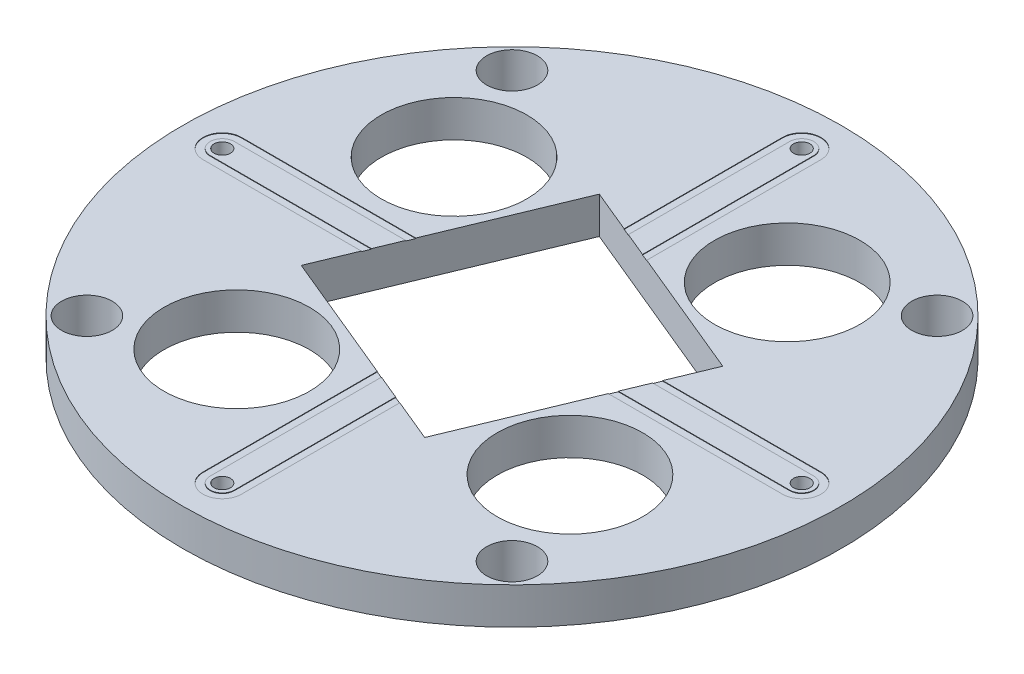
from build123d import *

# Parameters (mm, degrees)
BODAY_SKETCH_R        = 11.557
BODY_DEPTH            = 1.27
COPPER_START          = 0.017500092
COPPER_SKETCH_R       = 11.557
COPPER_DEPTH          = 0.017500092
F_0_CLEARANCE_HOLE1_D = 1.778
SCREW_HOLES_COUNT     = 4
GAP_CUT_DEPTH         = 17.39333395
CENTER_DEPTH          = 0.017500092
IO_HOLE_SKETCH_R      = 0.287000061
IO_HOLE_DEPTH         = 17.39333395
GAP_CUTS_COUNT        = 4
CENTERS_COUNT         = 4
IO_HOLES_COUNT        = 4
POCKET_DEPTH          = 17.39333395
POCKET_DEPTH_BACK     = 17.39333395
POSTS_R               = 2.5527
POST_CUT_DEPTH        = 17.39333395
POST_CUTS_COUNT       = 4


with BuildPart() as part:
    # Boday Sketch → Body (new body)
    with BuildSketch(Plane(origin=(0, 0, 0), x_dir=(1, 0, 0), z_dir=(0, 1, 0))):
        Circle(BODAY_SKETCH_R)
    extrude(amount=-BODY_DEPTH)

    # Copper Sketch → Copper (add)
    with BuildSketch(Plane(origin=(0, 0, 0), x_dir=(1, 0, 0), z_dir=(0, 1, 0)).offset(COPPER_START)):
        Circle(COPPER_SKETCH_R)
    extrude(amount=-COPPER_DEPTH)

    # #0 Clearance Hole1 (through all)
    with Locations(Plane(origin=(0, 0.017500092, 0), x_dir=(-1, 0, 0), z_dir=(0, 1, 0))):
        with Locations((7.45361258, -7.45361258)):
            f_0_clearance_hole1 = Hole(F_0_CLEARANCE_HOLE1_D / 2)

    # Screw Holes: #0 Clearance Hole1 ×4 about axis
    screw_holes_axis = Axis((0, 0.0762, 0), (0, -1, 0))
    for i in range(1, SCREW_HOLES_COUNT):
        add(f_0_clearance_hole1.rotate(screw_holes_axis, i * 360 / SCREW_HOLES_COUNT), mode=Mode.SUBTRACT)

    # Gap → Gap Cut (cut, through all)
    with BuildSketch(Plane(origin=(0, 0, 0), x_dir=(1, 0, 0), z_dir=(0, 1, 0))):
        with BuildLine():
            Line((0.675000047, 0), (0.675000047, 10.16))
            ThreePointArc((0.675000047, 10.16), (0, 10.835000047), (-0.675000047, 10.16))
            Line((-0.675000047, 10.16), (-0.675000047, 0))
            Line((-0.675000047, 0), (0.675000047, 0))
        make_face()
    gap_cut = extrude(amount=GAP_CUT_DEPTH, mode=Mode.SUBTRACT)


with BuildPart() as body_2:
    # Center Sketch → Center (new body)
    with BuildSketch(Plane(origin=(0, 0, 0), x_dir=(1, 0, 0), z_dir=(0, 1, 0))):
        with BuildLine():
            Line((0.425000039, 0), (0.425000039, 10.16))
            ThreePointArc((0.425000039, 10.16), (0, 10.585000039), (-0.425000039, 10.16))
            Line((-0.425000039, 10.16), (-0.425000039, 0))
            Line((-0.425000039, 0), (0.425000039, 0))
        make_face()
    center = extrude(amount=CENTER_DEPTH)


with BuildPart() as io_hole_tool:
    # IO Hole Sketch → IO Hole (new, symmetric)
    with BuildSketch(Plane(origin=(0, 0, 0), x_dir=(1, 0, 0), z_dir=(0, 1, 0))):
        with Locations((0, 10.16)):
            Circle(IO_HOLE_SKETCH_R)
    io_hole = extrude(amount=IO_HOLE_DEPTH, both=True)


with BuildPart() as part_1:
    add(part.part)

    # IO Hole: cut by io_hole_tool
    add(io_hole_tool.part, mode=Mode.SUBTRACT)

    # Gap Cuts: Gap Cut ×4 about axis
    gap_cuts_axis = Axis((0, 0.0762, 0), (0, -1, 0))
    for i in range(1, GAP_CUTS_COUNT):
        add(gap_cut.rotate(gap_cuts_axis, i * 360 / GAP_CUTS_COUNT), mode=Mode.SUBTRACT)



with BuildPart() as body_2_1:
    add(body_2.part)

    # IO Hole: cut by io_hole_tool
    add(io_hole_tool.part, mode=Mode.SUBTRACT)


with BuildPart() as part_2:
    add(part_1.part)

    add(body_2_1.part)  # Centers merges body 2
    # Centers: Center ×4 about axis
    centers_axis = Axis((0, 0.0762, 0), (0, -1, 0))
    for i in range(1, CENTERS_COUNT):
        add(center.rotate(centers_axis, i * 360 / CENTERS_COUNT))

    # IO Holes: IO Hole ×4 about axis
    io_holes_axis = Axis((0, 0.0762, 0), (0, -1, 0))
    for i in range(1, IO_HOLES_COUNT):
        add(io_hole.rotate(io_holes_axis, i * 360 / IO_HOLES_COUNT), mode=Mode.SUBTRACT)

    # Pocket Sketch → Pocket (cut, two sides: drawn at the far end of the back side and taken through both)
    with BuildSketch(Plane(origin=(0, 0, 0), x_dir=(1, 0, 0), z_dir=(0, 1, 0)).offset(-POCKET_DEPTH_BACK)):
        Polygon((-5.226251861, -2.164784401), (2.164784401, -5.226251861), (5.226251861, 2.164784401), (-2.164784401, 5.226251861), align=None)
    extrude(amount=POCKET_DEPTH + POCKET_DEPTH_BACK, mode=Mode.SUBTRACT)

    # Posts → Post Cut (cut, symmetric)
    with BuildSketch(Plane(origin=(0, 0, 0), x_dir=(1, 0, 0), z_dir=(0, 1, 0))):
        with Locations((3.81, 5.842)):
            Circle(POSTS_R)
    post_cut = extrude(amount=POST_CUT_DEPTH, both=True, mode=Mode.SUBTRACT)

    # Post Cuts: Post Cut ×4 about axis
    post_cuts_axis = Axis((0, 0.0762, 0), (0, -1, 0))
    for i in range(1, POST_CUTS_COUNT):
        add(post_cut.rotate(post_cuts_axis, i * 360 / POST_CUTS_COUNT), mode=Mode.SUBTRACT)


solid = part_2.part
